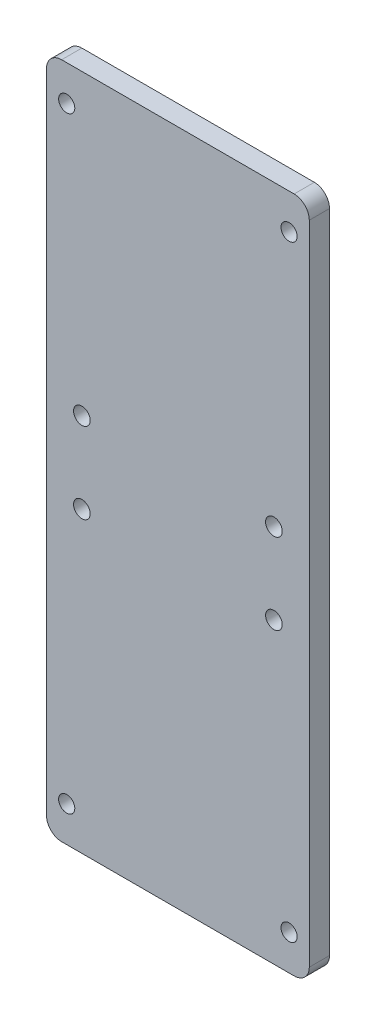
from build123d import *

# Parameters (mm, degrees)
SKETCH1_R           = 1.65
SKETCH1_R_2         = 1.6
BOSS_EXTRUDE1_DEPTH = 4


with BuildPart() as part:
    # Sketch1 → Boss-Extrude1 (new body)
    with BuildSketch(Plane.XY):
        with BuildLine():
            Line((23.206941284, 126.936391703), (23.206941284, -1.063608297))
            ThreePointArc((23.206941284, -1.063608297), (24.085620941, -3.184928641), (26.206941284, -4.063608297))
            Line((26.206941284, -4.063608297), (72.208519176, -4.063608297))
            ThreePointArc((72.208519176, -4.063608297), (74.32983952, -3.184928641), (75.208519176, -1.063608297))
            Line((75.208519176, -1.063608297), (75.208519176, 126.936391703))
            ThreePointArc((75.208519176, 126.936391703), (74.32983952, 129.057712046), (72.208519176, 129.936391703))
            Line((72.208519176, 129.936391703), (26.206941284, 129.936391703))
            ThreePointArc((26.206941284, 129.936391703), (24.085620941, 129.057712046), (23.206941284, 126.936391703))
        make_face()
        with Locations((30.20773023, 54.936391703)):
            Circle(SKETCH1_R, mode=Mode.SUBTRACT)
        with Locations((27.206941284, 2.936391703)):
            Circle(SKETCH1_R_2, mode=Mode.SUBTRACT)
        with Locations((68.20773023, 70.936391703)):
            Circle(SKETCH1_R, mode=Mode.SUBTRACT)
        with Locations((71.208519176, 122.936391703)):
            Circle(SKETCH1_R_2, mode=Mode.SUBTRACT)
        with Locations((71.208519176, 2.936391703)):
            Circle(SKETCH1_R_2, mode=Mode.SUBTRACT)
        with Locations((68.20773023, 54.936391703)):
            Circle(SKETCH1_R, mode=Mode.SUBTRACT)
        with Locations((27.206941284, 122.936391703)):
            Circle(SKETCH1_R_2, mode=Mode.SUBTRACT)
        with Locations((30.20773023, 70.936391703)):
            Circle(SKETCH1_R, mode=Mode.SUBTRACT)
    extrude(amount=BOSS_EXTRUDE1_DEPTH)


solid = part.part
